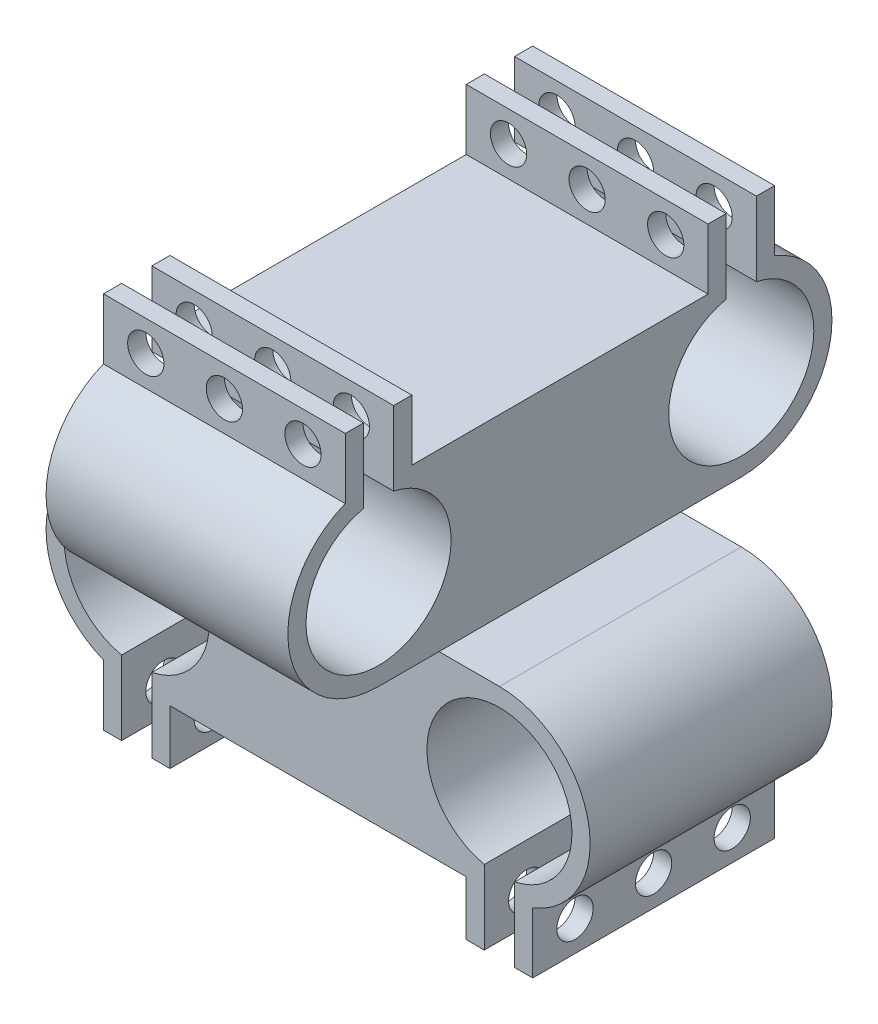
from build123d import *

# Parameters (mm, degrees)
EXTRUDE_1_DEPTH     = 20
SKETCH_2_R          = 1.5
CUT_EXTRUDE_1_DEPTH = 47.519485165
EXTRUDE_2_DEPTH     = 10
SKETCH_6_R          = 1.5
CUT_EXTRUDE_2_DEPTH = 54.43647957


with BuildPart() as part:
    # 스케치1 → 보스-돌출1 (new body)
    with BuildSketch(Plane(origin=(0, 0, 0), x_dir=(0, 0, -1), z_dir=(1, 0, 0))):
        with BuildLine():
            Line((-16.25, 12), (-17.75, 12))
            Line((-17.75, 12), (-17.75, 6.977642868))
            ThreePointArc((-17.75, 6.977642868), (-22.368253576, -1.399585383), (-15, -7.5))
            Line((-15, -7.5), (15, -7.5))
            ThreePointArc((15, -7.5), (22.368253576, -1.399585383), (17.75, 6.977642868))
            Line((17.75, 6.977642868), (17.75, 12))
            Line((17.75, 12), (16.25, 12))
            Line((16.25, 12), (16.25, 5.868347297))
            ThreePointArc((16.25, 5.868347297), (15, -6), (13.75, 5.868347297))
            Line((13.75, 5.868347297), (13.75, 12))
            Line((13.75, 12), (12.25, 12))
            Line((12.25, 12), (12.25, 6.977642868))
            Line((12.25, 6.977642868), (-12.25, 6.977642868))
            Line((-12.25, 6.977642868), (-12.25, 12))
            Line((-12.25, 12), (-13.75, 12))
            Line((-13.75, 12), (-13.75, 5.868347297))
            ThreePointArc((-13.75, 5.868347297), (-15, -6), (-16.25, 5.868347297))
            Line((-16.25, 5.868347297), (-16.25, 12))
        make_face()
    extrude(amount=EXTRUDE_1_DEPTH)

    # 스케치2 → 컷-돌출1 (cut, through all)
    with BuildSketch(Plane.XY.offset(17.75)):
        with Locations((3.5, 9.488821434)):
            Circle(SKETCH_2_R)
        with Locations((16.5, 9.488821434)):
            Circle(SKETCH_2_R)
        with Locations((10, 9.488821434)):
            Circle(SKETCH_2_R)
    extrude(amount=-CUT_EXTRUDE_1_DEPTH, mode=Mode.SUBTRACT)

    # 스케치5 → 보스-돌출2 (add, symmetric)
    with BuildSketch(Plane.XY):
        with BuildLine():
            Line((-2.25, -22.5), (22.25, -22.5))
            Line((22.25, -22.5), (22.25, -27.002682252))
            Line((22.25, -27.002682252), (23.75, -27.002682252))
            Line((23.75, -27.002682252), (23.75, -20.868347297))
            ThreePointArc((23.75, -20.868347297), (25, -9), (26.25, -20.868347297))
            Line((26.25, -20.868347297), (26.25, -27.002682252))
            Line((26.25, -27.002682252), (27.75, -27.002682252))
            Line((27.75, -27.002682252), (27.75, -21.977642868))
            ThreePointArc((27.75, -21.977642868), (32.368253576, -13.600414617), (25, -7.5))
            Line((25, -7.5), (-5, -7.5))
            ThreePointArc((-5, -7.5), (-12.368253576, -13.600414617), (-7.75, -21.977642868))
            Line((-7.75, -21.977642868), (-7.75, -27.002682252))
            Line((-7.75, -27.002682252), (-6.25, -27.002682252))
            Line((-6.25, -27.002682252), (-6.25, -20.868347297))
            ThreePointArc((-6.25, -20.868347297), (-5, -9), (-3.75, -20.868347297))
            Line((-3.75, -20.868347297), (-3.75, -27.002682252))
            Line((-3.75, -27.002682252), (-2.25, -27.002682252))
            Line((-2.25, -27.002682252), (-2.25, -22.5))
        make_face()
    extrude(amount=EXTRUDE_2_DEPTH, both=True)

    # 스케치6 → 컷-돌출2 (cut, through all)
    with BuildSketch(Plane(origin=(27.75, 0, 0), x_dir=(0, 0, -1), z_dir=(1, 0, 0))):
        with Locations((-6.5, -24.49016256)):
            Circle(SKETCH_6_R)
        with Locations((6.5, -24.49016256)):
            Circle(SKETCH_6_R)
        with Locations((0, -24.49016256)):
            Circle(SKETCH_6_R)
    extrude(amount=-CUT_EXTRUDE_2_DEPTH, mode=Mode.SUBTRACT)


solid = part.part
